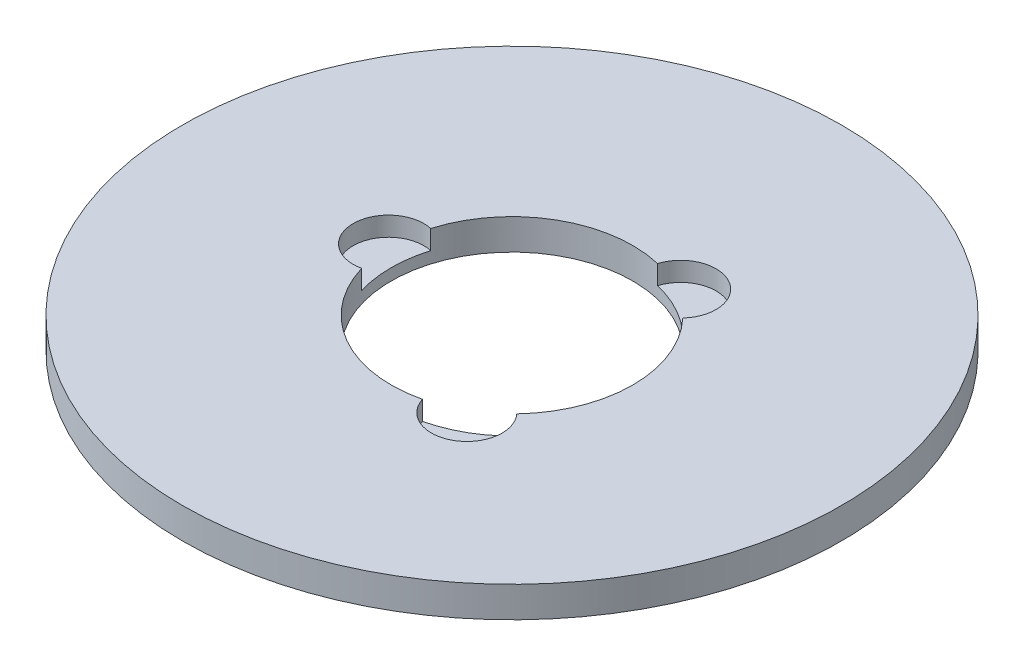
from build123d import *

# Parameters (mm, degrees)
SKETCH1_R           = 75
BOSS_EXTRUDE1_DEPTH = 7
SKETCH2_R           = 27.5
CUT_EXTRUDE1_DEPTH  = 107.296754419
SKETCH3_R           = 8.050093483
CUT_EXTRUDE2_DEPTH  = 4.365725987
CIRPATTERN1_COUNT   = 3


with BuildPart() as part:
    # Sketch1 → Boss-Extrude1 (new body)
    with BuildSketch(Plane(origin=(0, 0, 0), x_dir=(1, 0, 0), z_dir=(0, 1, 0))):
        Circle(SKETCH1_R)
    extrude(amount=BOSS_EXTRUDE1_DEPTH)

    # Sketch2 → Cut-Extrude1 (cut, through all)
    with BuildSketch(Plane(origin=(0, 0, 0), x_dir=(1, 0, 0), z_dir=(0, 1, 0))):
        Circle(SKETCH2_R)
    extrude(amount=CUT_EXTRUDE1_DEPTH, mode=Mode.SUBTRACT)

    # Sketch3 → Cut-Extrude2 (cut)
    with BuildSketch(Plane(origin=(0, 7, 0), x_dir=(1, 0, 0), z_dir=(0, 1, 0))):
        with Locations((-28.10224206, 0)):
            Circle(SKETCH3_R)
    cut_extrude2 = extrude(amount=-CUT_EXTRUDE2_DEPTH, mode=Mode.SUBTRACT)

    # CirPattern1: Cut-Extrude2 ×3 about axis
    cirpattern1_axis = Axis((0, 0, 0), (0, 1, 0))
    for i in range(1, CIRPATTERN1_COUNT):
        add(cut_extrude2.rotate(cirpattern1_axis, i * 360 / CIRPATTERN1_COUNT), mode=Mode.SUBTRACT)


solid = part.part
